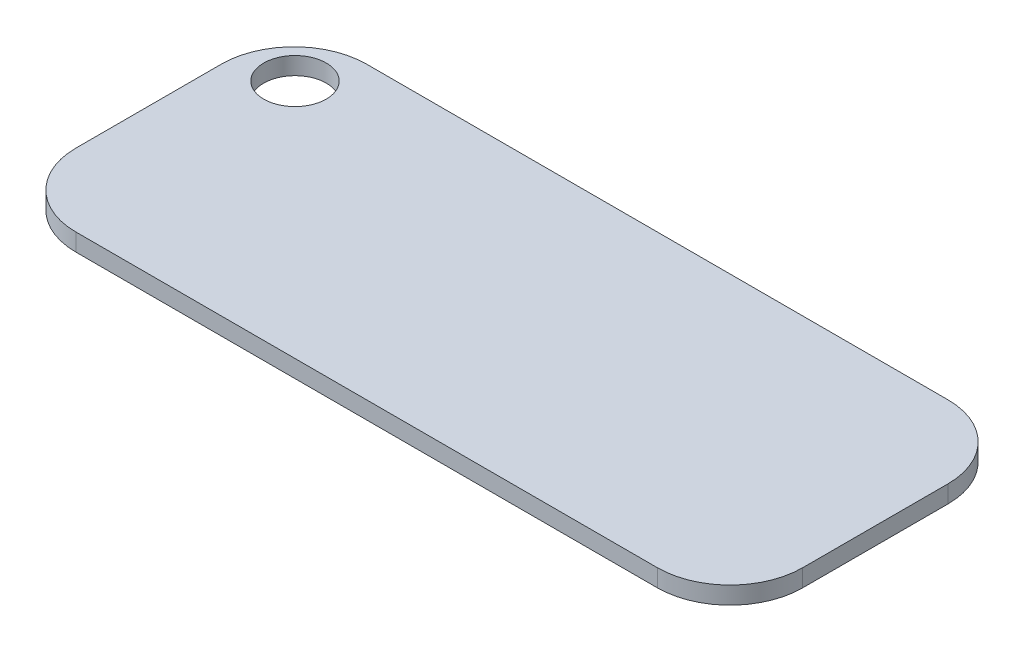
from build123d import *

# Parameters (mm, degrees)
SKETCH_1_W          = 50
SKETCH_1_H          = 20
EXTRUDE_1_DEPTH     = 1.2
FILLET_1_R          = 5
FILLET_2_R          = 5
FILLET_3_R          = 5
FILLET_4_R          = 5
SKETCH_4_R          = 2.151855383
CUT_EXTRUDE_1_DEPTH = 3
EXTRUDE_979_DEPTH   = 1.2


with BuildPart() as part:
    # Эскиз1 → Бобышка-Вытянуть1 (new body)
    with BuildSketch(Plane(origin=(0, 0, 0), x_dir=(1, 0, 0), z_dir=(0, 1, 0))):
        with Locations((25, 10)):
            Rectangle(SKETCH_1_W, SKETCH_1_H)
    extrude(amount=EXTRUDE_1_DEPTH)

    # Скругление1
    fillet_1_edges = [part.edges().sort_by_distance(p)[0] for p in [
        (0, 0.6, -20),
    ]]
    fillet(fillet_1_edges, radius=FILLET_1_R)

    # Скругление2
    fillet_2_edges = [part.edges().sort_by_distance(p)[0] for p in [
        (0, 0.6, 0),
    ]]
    fillet(fillet_2_edges, radius=FILLET_2_R)

    # Скругление3
    fillet_3_edges = [part.edges().sort_by_distance(p)[0] for p in [
        (50, 0.6, -20),
    ]]
    fillet(fillet_3_edges, radius=FILLET_3_R)

    # Скругление4
    fillet_4_edges = [part.edges().sort_by_distance(p)[0] for p in [
        (50, 0.6, 0),
    ]]
    fillet(fillet_4_edges, radius=FILLET_4_R)

    # Эскиз4 → Вырез-Вытянуть1 (cut)
    with BuildSketch(Plane(origin=(0, 1.2, 0), x_dir=(1, 0, 0), z_dir=(0, 1, 0))):
        with Locations((3.542470198, 16.528352227)):
            Circle(SKETCH_4_R)
    extrude(amount=-CUT_EXTRUDE_1_DEPTH, mode=Mode.SUBTRACT)

    # Эскиз5 → Extrude 979 (add)
    # profile 1 of 11: a face of its own
    with BuildSketch(Plane.XZ):
        with BuildLine():
            add(Edge.make_bspline(
                [(7.715824337, -9.249564735), (7.766160171, -9.176893377), (7.868399459, -9.029287442), (7.996414769, -8.785756318), (8.103367923, -8.521510996), (8.188804118, -8.238982947), (8.255316002, -7.946402964), (8.304601491, -7.648663525), (8.336266424, -7.348929067), (8.339569292, -7.147840455), (8.341222147, -7.047209679)],
                knots=[0, 0, 0, 0, 0.911528828, 1.851445597, 2.831681584, 3.849114504, 4.893651631, 5.925632796, 6.961924405, 8, 8, 8, 8], degree=3))
            add(Edge.make_bspline(
                [(8.341222147, -7.047209679), (8.337394851, -6.891153613), (8.329939431, -6.587162586), (8.267622497, -6.145599666), (8.161016823, -5.733040581), (8.040195925, -5.411343759), (7.920866369, -5.176566761), (7.816636073, -5.024690155), (7.700589323, -4.894824065), (7.57301853, -4.785487202), (7.432664091, -4.698075234), (7.279477201, -4.633073953), (7.11396188, -4.591366872), (6.999065368, -4.580856826), (6.940392326, -4.575489767)],
                knots=[0, 0, 0, 0, 1.791554521, 3.489877151, 5.107255168, 6.676714242, 7.425606061, 8.126241729, 8.785513885, 9.420356286, 10.049181088, 10.676513228, 11.324148379, 12, 12, 12, 12], degree=3))
            add(Edge.make_bspline(
                [(6.940392326, -4.575489767), (6.886154354, -4.578981174), (6.779670769, -4.585835735), (6.62434705, -4.6225053), (6.478204695, -4.682081581), (6.338875865, -4.761319869), (6.210355825, -4.865395681), (6.088418762, -4.988989621), (5.976134626, -5.135480832), (5.869842889, -5.301237743), (5.777518117, -5.487913377), (5.693397188, -5.690264555), (5.625099885, -5.909667908), (5.565744196, -6.144202547), (5.521739832, -6.395782298), (5.487528778, -6.663100805), (5.467193402, -6.946988163), (5.462691185, -7.141447456), (5.460376971, -7.241402777)],
                knots=[0, 0, 0, 0, 0.776059093, 1.523610694, 2.26943235, 3.026161316, 3.806370488, 4.625991605, 5.503091466, 6.44030775, 7.436849706, 8.476373815, 9.570387437, 10.718835958, 11.933161742, 13.219262995, 14.570654791, 16, 16, 16, 16], degree=3))
            add(Edge.make_bspline(
                [(5.460376971, -7.241402777), (5.461733402, -7.345205977), (5.464420127, -7.550812276), (5.499663986, -7.854600872), (5.545950319, -8.15144279), (5.618583069, -8.436552089), (5.706959288, -8.707307365), (5.817377371, -8.95757857), (5.94385666, -9.187967423), (6.046973839, -9.325194542), (6.09763199, -9.39260981)],
                knots=[0, 0, 0, 0, 1.089978603, 2.15895528, 3.20972959, 4.244258845, 5.246508595, 6.198517637, 7.11498969, 8, 8, 8, 8], degree=3))
            Line((6.09763199, -9.39260981), (6.098988941, -9.431083139))
            add(Edge.make_bspline(
                [(6.098988941, -9.431083139), (6.046580047, -9.498179954), (5.938103195, -9.637058121), (5.80181535, -9.878082081), (5.673590401, -10.149278895), (5.558843048, -10.455320285), (5.462126569, -10.794625262), (5.393998298, -11.167724706), (5.350100346, -11.572957062), (5.343261965, -11.854153872), (5.339713299, -12.000076353)],
                knots=[0, 0, 0, 0, 0.747893007, 1.548002103, 2.428220339, 3.385024111, 4.419108458, 5.527032265, 6.716693888, 8, 8, 8, 8], degree=3))
            add(Edge.make_bspline(
                [(5.339713299, -12.000076353), (5.341460028, -12.088714681), (5.344907765, -12.263671173), (5.363210958, -12.521189627), (5.396133876, -12.769570928), (5.438259342, -13.008486954), (5.495174212, -13.237691812), (5.565127734, -13.457488871), (5.647994331, -13.667675748), (5.740686073, -13.867401609), (5.847142457, -14.049851366), (5.966225553, -14.211430483), (6.096353113, -14.350581813), (6.239746772, -14.465688202), (6.395620193, -14.556592916), (6.56288249, -14.625344729), (6.742847885, -14.669528283), (6.867251127, -14.679656034), (6.930965477, -14.684843061)],
                knots=[0, 0, 0, 0, 1.235435888, 2.438533473, 3.595508883, 4.725923701, 5.817781028, 6.884189936, 7.938117332, 8.96461166, 9.950003493, 10.876660607, 11.756436375, 12.597656396, 13.429845812, 14.262588117, 15.110167343, 16, 16, 16, 16], degree=3))
            add(Edge.make_bspline(
                [(6.930965477, -14.684843061), (6.991511404, -14.680891948), (7.110089376, -14.673153771), (7.283066801, -14.632398981), (7.446200449, -14.567081516), (7.602237529, -14.480753214), (7.746832747, -14.366618204), (7.882516527, -14.230276873), (8.009592496, -14.070318157), (8.125555071, -13.887279037), (8.230381242, -13.6839446), (8.323136301, -13.462891651), (8.400042388, -13.223587077), (8.463377726, -12.967709417), (8.514540453, -12.69451849), (8.551195511, -12.404916175), (8.576878379, -12.097933978), (8.580623482, -11.887637871), (8.582549491, -11.779488077)],
                knots=[0, 0, 0, 0, 0.789717121, 1.546644996, 2.30406014, 3.074123165, 3.86213959, 4.696104222, 5.576133471, 6.519015237, 7.51540899, 8.554319549, 9.6395583, 10.787721216, 11.987677943, 13.259577382, 14.590672234, 16, 16, 16, 16], degree=3))
            add(Edge.make_bspline(
                [(8.582549491, -11.779488077), (8.577820294, -11.63292157), (8.568700342, -11.350277531), (8.520368129, -10.944489132), (8.442013688, -10.574388766), (8.334499032, -10.241270976), (8.204414839, -9.945234791), (8.059515493, -9.685142102), (7.900128955, -9.460103805), (7.775482844, -9.335769684), (7.715279347, -9.275716877)],
                knots=[0, 0, 0, 0, 1.293490065, 2.494412024, 3.600539669, 4.62641707, 5.577396771, 6.448871158, 7.250811916, 8, 8, 8, 8], degree=3))
            Line((7.715279347, -9.275716877), (7.715824337, -9.249564735))
        make_face()
        with BuildLine():
            add(Edge.make_bspline(
                [(6.957920374, -13.372625625), (6.93174407, -13.369906454), (6.880375206, -13.364570303), (6.80704592, -13.338292077), (6.737587182, -13.300959376), (6.676167386, -13.245401765), (6.613927997, -13.182001522), (6.561187135, -13.101286196), (6.50856116, -13.010335686), (6.449580785, -12.866051618), (6.383209027, -12.666896386), (6.33061405, -12.404759735), (6.29558552, -12.11917452), (6.291868831, -11.920378658), (6.289939718, -11.817195475)],
                knots=[0, 0, 0, 0, 0.516878197, 1.014331308, 1.524422578, 2.060470795, 2.63878414, 3.270961343, 3.953097661, 4.707736148, 6.337157177, 8.083774507, 9.967318802, 12, 12, 12, 12], degree=3))
            add(Edge.make_bspline(
                [(6.289939718, -11.817195475), (6.29252905, -11.720988293), (6.297583526, -11.533188204), (6.324740909, -11.259280602), (6.374704875, -11.00239966), (6.438854186, -10.763165395), (6.522319536, -10.546834695), (6.623308185, -10.359265739), (6.74041941, -10.201548361), (6.834542713, -10.120139111), (6.88006049, -10.080769816)],
                knots=[0, 0, 0, 0, 1.22142396, 2.384266159, 3.488789828, 4.539640758, 5.524731502, 6.424298786, 7.237995119, 8, 8, 8, 8], degree=3))
            add(Edge.make_bspline(
                [(6.88006049, -10.080769816), (6.933694214, -10.119924752), (7.043488746, -10.200079505), (7.184647699, -10.356964741), (7.311950603, -10.541971104), (7.422794465, -10.758524875), (7.516173227, -11.006383783), (7.579908827, -11.288007859), (7.621718216, -11.600416233), (7.62868317, -11.819562187), (7.632323072, -11.934088407)],
                knots=[0, 0, 0, 0, 0.764838737, 1.565714712, 2.420999668, 3.352265673, 4.366974192, 5.470323704, 6.677984882, 8, 8, 8, 8], degree=3))
            add(Edge.make_bspline(
                [(7.632323072, -11.934088407), (7.63037494, -12.029103614), (7.626619945, -12.212243918), (7.591705972, -12.475991169), (7.53793278, -12.718127104), (7.464914984, -12.935040245), (7.373033711, -13.119069678), (7.255852245, -13.258259904), (7.114400274, -13.349030169), (7.009413566, -13.364804591), (6.957920374, -13.372625625)],
                knots=[0, 0, 0, 0, 1.321228345, 2.546646677, 3.694107777, 4.76689393, 5.725035891, 6.536813707, 7.27454525, 8, 8, 8, 8], degree=3))
        make_face(mode=Mode.SUBTRACT)
        with BuildLine():
            add(Edge.make_bspline(
                [(6.907634025, -5.865368148), (6.958753454, -5.873659232), (7.059757483, -5.890041121), (7.193993752, -5.980033754), (7.300393439, -6.115510071), (7.377335324, -6.294038532), (7.435873132, -6.498811019), (7.482230578, -6.723734581), (7.508269288, -6.964256115), (7.510511526, -7.130104495), (7.5116594, -7.215007599)],
                knots=[0, 0, 0, 0, 0.765528405, 1.512564887, 2.346431841, 3.307864738, 4.394490714, 5.524415916, 6.732669124, 8, 8, 8, 8], degree=3))
            add(Edge.make_bspline(
                [(7.5116594, -7.215007599), (7.50859169, -7.297439341), (7.502600293, -7.458432863), (7.471378816, -7.69346882), (7.426042105, -7.916173214), (7.35914447, -8.122395419), (7.28290024, -8.309044003), (7.193034854, -8.469161507), (7.097490457, -8.604667209), (7.019040236, -8.673650731), (6.981870464, -8.706335173)],
                knots=[0, 0, 0, 0, 1.216519099, 2.375925702, 3.494449087, 4.564888535, 5.570675503, 6.463263841, 7.271893284, 8, 8, 8, 8], degree=3))
            add(Edge.make_bspline(
                [(6.981870464, -8.706335173), (6.931695132, -8.668071043), (6.830544781, -8.590932935), (6.697820701, -8.448639437), (6.581068942, -8.285285136), (6.478238966, -8.101310609), (6.395255322, -7.895023443), (6.335588691, -7.666397936), (6.297036284, -7.416145748), (6.292365036, -7.241553526), (6.289939718, -7.150905023)],
                knots=[0, 0, 0, 0, 0.854607252, 1.722835104, 2.626488507, 3.572752242, 4.57465509, 5.633219383, 6.771164507, 8, 8, 8, 8], degree=3))
            add(Edge.make_bspline(
                [(6.289939718, -7.150905023), (6.290938527, -7.070998742), (6.292879216, -6.915740642), (6.320899811, -6.68949647), (6.362615181, -6.475473911), (6.425043796, -6.279448537), (6.503565055, -6.107193558), (6.611838523, -5.974725557), (6.750949296, -5.890187314), (6.853849406, -5.874822953), (6.906455668, -5.866968135)],
                knots=[0, 0, 0, 0, 1.230812713, 2.391472128, 3.50850541, 4.586815455, 5.557221012, 6.409314627, 7.186784035, 8, 8, 8, 8], degree=3))
            Line((6.906455668, -5.866968135), (6.907634025, -5.865368148))
        make_face(mode=Mode.SUBTRACT)
    # profile 2 of 11: a face of its own
    with BuildSketch(Plane.XZ):
        with BuildLine():
            add(Edge.make_bspline(
                [(9.746879914, -14.683467699), (9.806749079, -14.685791262), (9.925235476, -14.6903898), (10.100699733, -14.675658277), (10.270881849, -14.649549564), (10.435392675, -14.610724633), (10.592746251, -14.555039106), (10.744022731, -14.486850339), (10.890198177, -14.406395381), (11.027138099, -14.308508146), (11.161504369, -14.201147354), (11.286074377, -14.076447402), (11.406244824, -13.939039253), (11.520766087, -13.788857432), (11.629050834, -13.624078956), (11.727566217, -13.443723049), (11.824734414, -13.252250259), (11.942845085, -12.973969885), (12.076790331, -12.603481692), (12.216678947, -12.133388078), (12.33202696, -11.633107276), (12.42862629, -11.104752191), (12.500815328, -10.547716704), (12.553819553, -9.962234985), (12.58373682, -9.347051286), (12.586942869, -8.926955308), (12.588583411, -8.711991283)],
                knots=[0, 0, 0, 0, 0.587702947, 1.163116348, 1.725075362, 2.277262808, 2.819713187, 3.360969282, 3.905101247, 4.454524283, 5.011482261, 5.591737658, 6.182009412, 6.802709751, 7.444427068, 8.115602503, 8.819201884, 9.551563824, 11.081795736, 12.684480665, 14.363626865, 16.119590269, 17.955514458, 19.875934814, 21.889706872, 24, 24, 24, 24], degree=3))
            add(Edge.make_bspline(
                [(12.588583411, -8.711991283), (12.586869387, -8.563030602), (12.583519526, -8.271904287), (12.565205506, -7.846144898), (12.532738134, -7.441899869), (12.490283225, -7.058732993), (12.434284214, -6.696886678), (12.364380963, -6.357281746), (12.283783668, -6.039182346), (12.19099992, -5.744535764), (12.085308111, -5.47784443), (11.96638436, -5.242916146), (11.835179087, -5.042250894), (11.691586972, -4.873822341), (11.531300664, -4.744759813), (11.360601652, -4.647552011), (11.176124881, -4.584688618), (11.047449676, -4.572326808), (10.982248274, -4.566062918)],
                knots=[0, 0, 0, 0, 1.488694986, 2.909481093, 4.257746305, 5.540848802, 6.761339651, 7.915469393, 9.004609899, 10.039448099, 11.000449599, 11.868389147, 12.666188125, 13.391717201, 14.070478316, 14.711614416, 15.347158253, 16, 16, 16, 16], degree=3))
            add(Edge.make_bspline(
                [(10.982248274, -4.566062918), (10.92019111, -4.57182076), (10.796792087, -4.583270078), (10.619698699, -4.643474711), (10.452292388, -4.727868466), (10.296452647, -4.844843279), (10.151846729, -4.990751688), (10.017494506, -5.166856512), (9.892833702, -5.371478242), (9.782601041, -5.604506959), (9.680657336, -5.857274449), (9.5955512, -6.127751164), (9.519348562, -6.411165401), (9.457050148, -6.708814108), (9.411315525, -7.021282488), (9.37440803, -7.346884117), (9.35468867, -7.687374952), (9.350017291, -7.918858385), (9.347632589, -8.037028866)],
                knots=[0, 0, 0, 0, 0.71661271, 1.42496533, 2.141431373, 2.872130828, 3.661492946, 4.503891963, 5.421382964, 6.41994004, 7.473922347, 8.56282292, 9.6881508, 10.858187346, 12.067902601, 13.329498283, 14.63672978, 16, 16, 16, 16], degree=3))
            add(Edge.make_bspline(
                [(9.347632589, -8.037028866), (9.349832703, -8.151446831), (9.354115508, -8.374176098), (9.375995599, -8.698562206), (9.404389508, -9.004566486), (9.44790215, -9.290833302), (9.502620155, -9.558297018), (9.567618616, -9.806692284), (9.645098143, -10.036007703), (9.732612398, -10.245016967), (9.831111693, -10.431534039), (9.933318904, -10.596172531), (10.043831438, -10.736839392), (10.161808551, -10.851531059), (10.286209414, -10.943393297), (10.418135522, -11.007161173), (10.555813078, -11.05219231), (10.651328277, -11.058157346), (10.699442792, -11.061162153)],
                knots=[0, 0, 0, 0, 1.529770763, 2.977895321, 4.345668482, 5.637335493, 6.846838563, 7.994249315, 9.067689445, 10.080490039, 11.020068362, 11.884879202, 12.668265517, 13.405073479, 14.079029672, 14.725341234, 15.357907549, 16, 16, 16, 16], degree=3))
            add(Edge.make_bspline(
                [(10.699442792, -11.061162153), (10.749347102, -11.057904189), (10.848200738, -11.051450608), (10.990907393, -11.010821247), (11.123428435, -10.945280034), (11.245873661, -10.855172817), (11.355049257, -10.74006041), (11.460782692, -10.610059787), (11.552186957, -10.458040149), (11.604115759, -10.348336537), (11.630815513, -10.291931242)],
                knots=[0, 0, 0, 0, 0.935406275, 1.852912324, 2.759079899, 3.694486174, 4.685786001, 5.725263117, 6.830419519, 8, 8, 8, 8], degree=3))
            Line((11.630815513, -10.291931242), (11.650930421, -10.304570953))
            add(Edge.make_bspline(
                [(11.650930421, -10.304570953), (11.641221203, -10.397866701), (11.622172671, -10.580903812), (11.581113216, -10.848610475), (11.53780525, -11.105147937), (11.481806627, -11.34943515), (11.42070282, -11.582474068), (11.350144311, -11.804322472), (11.273806089, -12.014864286), (11.189142007, -12.212650827), (11.098109343, -12.395918856), (10.996574073, -12.560106178), (10.886598572, -12.704640128), (10.769276785, -12.830679762), (10.642933971, -12.937021092), (10.507497259, -13.022346658), (10.365255537, -13.090141234), (10.265039818, -13.118830601), (10.214902733, -13.133183651)],
                knots=[0, 0, 0, 0, 1.339989936, 2.628928885, 3.868993049, 5.056241457, 6.208438896, 7.310307185, 8.381264534, 9.407037606, 10.382860463, 11.30231499, 12.160773156, 12.973890012, 13.757980097, 14.51278177, 15.255957167, 16, 16, 16, 16], degree=3))
            add(Edge.make_bspline(
                [(10.214902733, -13.133183651), (10.181551834, -13.138582655), (10.120456644, -13.148473038), (10.037401857, -13.165557307), (9.969681393, -13.173210644), (9.902426193, -13.185134235), (9.82849182, -13.186765219), (9.773002777, -13.17741831), (9.745445633, -13.172776418)],
                knots=[0, 0, 0, 0, 1.282317147, 2.349064382, 3.21602214, 3.867087612, 4.940746315, 6, 6, 6, 6], degree=3))
            Line((9.745445633, -13.172776418), (9.746879914, -14.683467699))
        make_face()
        with BuildLine():
            add(Edge.make_bspline(
                [(10.949543367, -5.876398667), (10.977804564, -5.880640786), (11.035119189, -5.889243941), (11.115297351, -5.929014107), (11.188144281, -5.988144472), (11.257532058, -6.064937627), (11.318083799, -6.164193214), (11.374955345, -6.282252025), (11.425287822, -6.420732366), (11.485906995, -6.638386013), (11.5495803, -6.944821118), (11.600062876, -7.348941738), (11.63231325, -7.797065926), (11.636280204, -8.11049722), (11.638356992, -8.274585471)],
                knots=[0, 0, 0, 0, 0.388324956, 0.787535614, 1.2030177, 1.664837744, 2.193361997, 2.784441419, 3.452382468, 4.202091393, 5.868356787, 7.720494359, 9.759583653, 12, 12, 12, 12], degree=3))
            add(Edge.make_bspline(
                [(11.638356992, -8.274585471), (11.63876574, -8.319841589), (11.639537997, -8.405345005), (11.634448164, -8.525960585), (11.631699085, -8.632259893), (11.62385486, -8.749176617), (11.615048889, -8.872233208), (11.594648351, -8.962260682), (11.585566636, -9.002338244)],
                knots=[0, 0, 0, 0, 1.11380462, 2.104336476, 2.971181265, 3.730606527, 4.989733304, 6, 6, 6, 6], degree=3))
            add(Edge.make_bspline(
                [(11.585566636, -9.002338244), (11.555831834, -9.097405435), (11.498203191, -9.281653961), (11.378343184, -9.487551177), (11.26559534, -9.622058024), (11.173129126, -9.697058423), (11.070570318, -9.745119038), (10.997798069, -9.753961936), (10.961509205, -9.758371566)],
                knots=[0, 0, 0, 0, 1.717293694, 3.328265295, 4.075010403, 4.73980506, 5.371586794, 6, 6, 6, 6], degree=3))
            add(Edge.make_bspline(
                [(10.961509205, -9.758371566), (10.93680703, -9.756288935), (10.887466675, -9.752129068), (10.81566893, -9.726420604), (10.749856912, -9.684062288), (10.687738263, -9.626591417), (10.628412973, -9.555944951), (10.573027149, -9.469008351), (10.52297173, -9.366858202), (10.457817514, -9.204476703), (10.39162769, -8.966720574), (10.334330785, -8.642323418), (10.299599682, -8.269034586), (10.294760983, -8.003798002), (10.292202898, -7.863574837)],
                knots=[0, 0, 0, 0, 0.413789282, 0.826506569, 1.261562931, 1.716042024, 2.238855857, 2.802250335, 3.437615293, 4.141140511, 5.729823065, 7.558733105, 9.652026376, 12, 12, 12, 12], degree=3))
            add(Edge.make_bspline(
                [(10.292202898, -7.863574837), (10.294961987, -7.72524339), (10.300225719, -7.461337582), (10.333358307, -7.085096314), (10.388597617, -6.74882214), (10.454004327, -6.496676145), (10.514976333, -6.318557732), (10.566291983, -6.206445304), (10.617783946, -6.108098477), (10.676793407, -6.029229338), (10.737169657, -5.964075945), (10.803795424, -5.918721859), (10.874304734, -5.888000953), (10.923512636, -5.881537632), (10.948311616, -5.878280354)],
                knots=[0, 0, 0, 0, 2.244031887, 4.281116543, 6.121417338, 7.765846703, 8.501017567, 9.171798035, 9.76494997, 10.29714384, 10.765780613, 11.198437351, 11.596041788, 12, 12, 12, 12], degree=3))
            Line((10.948311616, -5.878280354), (10.949543367, -5.876398667))
        make_face(mode=Mode.SUBTRACT)
    # profile 3 of 11: a face of its own
    with BuildSketch(Plane.XZ):
        Polygon((15.629309794, -4.687908629), (14.811059267, -4.687908629), (13.624055062, -5.875750571), (13.829913886, -7.242157661), (14.666215357, -6.35598963), (14.679081534, -6.35598963), (14.679081534, -14.487884509), (15.629309794, -14.487884509), align=None)
    # profile 4 of 11: a face of its own
    with BuildSketch(Plane.XZ):
        with BuildLine():
            add(Edge.make_bspline(
                [(18.972766926, -14.673530842), (19.03576325, -14.668102479), (19.162148546, -14.657211918), (19.344728517, -14.590406449), (19.513878924, -14.480532201), (19.671691523, -14.331143763), (19.813891716, -14.138422555), (19.94826018, -13.908570439), (20.069298666, -13.637433252), (20.179271401, -13.327583953), (20.279331022, -12.980913937), (20.361863761, -12.597453334), (20.435961623, -12.180014656), (20.495200471, -11.727634509), (20.542085664, -11.240288198), (20.575245658, -10.718395021), (20.596267551, -10.161384017), (20.599160231, -9.778501893), (20.600651252, -9.581146798)],
                knots=[0, 0, 0, 0, 0.529751383, 1.062804646, 1.61385316, 2.215574753, 2.879125032, 3.620281667, 4.450123201, 5.370886135, 6.382468459, 7.480938196, 8.666507297, 9.945632662, 11.315014225, 12.78147403, 14.341023359, 16, 16, 16, 16], degree=3))
            add(Edge.make_bspline(
                [(20.600651252, -9.581146798), (20.600471641, -9.410187118), (20.600119587, -9.075088507), (20.581353726, -8.582945817), (20.556684217, -8.111290272), (20.517148116, -7.660404918), (20.464397977, -7.230997445), (20.400434619, -6.822213548), (20.32496942, -6.434220694), (20.2411293, -6.068849042), (20.14089918, -5.735857456), (20.027927625, -5.440781042), (19.895694797, -5.189324204), (19.74911186, -4.979799798), (19.587738389, -4.81009163), (19.407253239, -4.68815149), (19.212208345, -4.603037297), (19.073700235, -4.585986901), (19.003742964, -4.577375137)],
                knots=[0, 0, 0, 0, 1.462772537, 2.867185112, 4.213715228, 5.503936185, 6.739261869, 7.915146218, 9.043642378, 10.121075315, 11.121384378, 12.017154031, 12.820647149, 13.545818879, 14.199911066, 14.811456886, 15.399694113, 16, 16, 16, 16], degree=3))
            add(Edge.make_bspline(
                [(19.003742964, -4.577375137), (18.936398008, -4.58420557), (18.802208066, -4.597815726), (18.611344159, -4.676924424), (18.433505392, -4.793253707), (18.271596868, -4.955184615), (18.12267181, -5.156637113), (17.990253475, -5.401598252), (17.867438131, -5.685951925), (17.76060482, -6.01150079), (17.665916283, -6.371305995), (17.584066181, -6.760435346), (17.511253481, -7.175813241), (17.456707415, -7.619633952), (17.410942073, -8.090444969), (17.379628934, -8.589090372), (17.360445021, -9.114677258), (17.358705732, -9.474291788), (17.357815059, -9.658446963)],
                knots=[0, 0, 0, 0, 0.566917839, 1.129626877, 1.717802694, 2.346074211, 3.045200701, 3.819275146, 4.683807342, 5.648743943, 6.699322103, 7.813300624, 8.993971249, 10.246825329, 11.574997533, 12.974020352, 14.450424652, 16, 16, 16, 16], degree=3))
            add(Edge.make_bspline(
                [(17.357815059, -9.658446963), (17.358050533, -9.830032088), (17.35851212, -10.16638136), (17.376475076, -10.659859561), (17.40388833, -11.132718633), (17.444835636, -11.584273236), (17.500039313, -12.015497517), (17.565324135, -12.425602543), (17.642199833, -12.815182532), (17.731310552, -13.179839736), (17.831595468, -13.513907302), (17.950667773, -13.807809335), (18.08098519, -14.061191552), (18.228124823, -14.271889237), (18.391269004, -14.439542632), (18.570244405, -14.563384484), (18.764616178, -14.647478301), (18.902403718, -14.6648136), (18.971691676, -14.673530842)],
                knots=[0, 0, 0, 0, 1.464767554, 2.871306572, 4.215045025, 5.508116909, 6.741261956, 7.92587706, 9.052808243, 10.130273157, 11.12984833, 12.027539368, 12.833925245, 13.557426221, 14.213772112, 14.819481535, 15.406363497, 16, 16, 16, 16], degree=3))
            Line((18.971691676, -14.673530842), (18.972766926, -14.673530842))
        make_face()
        with BuildLine():
            add(Edge.make_bspline(
                [(18.979282867, -13.1426105), (18.952338234, -13.138634448), (18.896466738, -13.130389839), (18.818309136, -13.082670508), (18.748649535, -13.008182197), (18.684677145, -12.907176417), (18.625283396, -12.780368181), (18.57129502, -12.62671794), (18.523157271, -12.446195341), (18.478137311, -12.239274359), (18.439017432, -12.005169409), (18.406119931, -11.74403528), (18.374783935, -11.456311501), (18.354844607, -11.141034987), (18.331732973, -10.799352398), (18.32081641, -10.430231948), (18.310179722, -10.033694992), (18.308770368, -9.76026622), (18.308041478, -9.618854195)],
                knots=[0, 0, 0, 0, 0.348295693, 0.722214362, 1.152022054, 1.655502919, 2.257207495, 2.954417897, 3.752591885, 4.664981709, 5.684162841, 6.811961843, 8.058606191, 9.415432032, 10.884928106, 12.474287767, 14.176570434, 16, 16, 16, 16], degree=3))
            add(Edge.make_bspline(
                [(18.308041478, -9.618854195), (18.30941896, -9.477441654), (18.312082503, -9.204001949), (18.324212127, -8.807444082), (18.338369674, -8.438438755), (18.358806594, -8.096443906), (18.385710923, -7.781624632), (18.414479727, -7.493460125), (18.451044809, -7.232723351), (18.489010998, -6.99896953), (18.534679102, -6.793465289), (18.582206656, -6.613711289), (18.638585677, -6.46294573), (18.696145907, -6.336085282), (18.761633977, -6.238480326), (18.829727209, -6.16365709), (18.908122446, -6.11856598), (18.963677634, -6.111643396), (18.990545375, -6.108295479)],
                knots=[0, 0, 0, 0, 1.828192425, 3.535049952, 5.128793054, 6.602054755, 7.963618568, 9.213457478, 10.345225998, 11.367018811, 12.273810474, 13.066196316, 13.7679736, 14.353056012, 14.862318632, 15.281738881, 15.652632741, 16, 16, 16, 16], degree=3))
            add(Edge.make_bspline(
                [(18.990545375, -6.108295479), (19.018784895, -6.112078021), (19.076896818, -6.119861819), (19.157008041, -6.169820022), (19.227111205, -6.24744369), (19.292894745, -6.350850206), (19.352073958, -6.4825727), (19.406623673, -6.641522724), (19.451838802, -6.829429827), (19.495187156, -7.043161198), (19.532215099, -7.282916854), (19.564141873, -7.547019494), (19.589455751, -7.835091299), (19.612742116, -8.146146123), (19.628690247, -8.480629755), (19.642403665, -8.838842231), (19.649780265, -9.221009753), (19.650205916, -9.483733299), (19.650424832, -9.618854195)],
                knots=[0, 0, 0, 0, 0.365144164, 0.751401903, 1.188481301, 1.711676837, 2.330067746, 3.052575452, 3.882751645, 4.828291963, 5.87357693, 7.020192641, 8.269339261, 9.614396851, 11.055335144, 12.60115741, 14.251947096, 16, 16, 16, 16], degree=3))
            add(Edge.make_bspline(
                [(19.650424832, -9.618854195), (19.650438022, -9.757750523), (19.65046363, -10.027409233), (19.639962692, -10.418951375), (19.626819525, -10.784722199), (19.611411543, -11.124953243), (19.585861364, -11.43910408), (19.558475536, -11.728413997), (19.525144709, -11.991992139), (19.485264431, -12.229541748), (19.443306654, -12.440750382), (19.394748937, -12.624167144), (19.341259616, -12.779978206), (19.280664663, -12.9073605), (19.21797555, -13.009895539), (19.147612996, -13.084342909), (19.069242801, -13.133104141), (19.012501383, -13.139498708), (18.984889265, -13.1426105)],
                knots=[0, 0, 0, 0, 1.790021536, 3.475217123, 5.04755471, 6.507297142, 7.864016094, 9.109190405, 10.252463025, 11.287084988, 12.2131664, 13.026557634, 13.73103331, 14.332422383, 14.842437598, 15.272019921, 15.645742526, 16, 16, 16, 16], degree=3))
            Line((18.984889265, -13.1426105), (18.979282867, -13.1426105))
        make_face(mode=Mode.SUBTRACT)
    # profile 5 of 11: a face of its own
    with BuildSketch(Plane.XZ):
        with BuildLine():
            add(Edge.make_bspline(
                [(21.764981674, -14.683467699), (21.824850839, -14.685791262), (21.943337236, -14.6903898), (22.118801493, -14.675658277), (22.288983609, -14.649549564), (22.453494435, -14.610724633), (22.610848012, -14.555039106), (22.762124491, -14.486850339), (22.908299937, -14.406395381), (23.045239859, -14.308508146), (23.17960613, -14.201147354), (23.304176137, -14.076447402), (23.424346584, -13.939039253), (23.538867847, -13.788857432), (23.647152594, -13.624078956), (23.745667977, -13.443723049), (23.842836174, -13.252250259), (23.960946845, -12.973969885), (24.094892092, -12.603481692), (24.234780707, -12.133388078), (24.350128721, -11.633107276), (24.446728051, -11.104752191), (24.518917088, -10.547716704), (24.571921313, -9.962234985), (24.60183858, -9.347051286), (24.605044629, -8.926955308), (24.606685172, -8.711991283)],
                knots=[0, 0, 0, 0, 0.587702947, 1.163116348, 1.725075362, 2.277262808, 2.819713187, 3.360969282, 3.905101247, 4.454524283, 5.011482261, 5.591737658, 6.182009412, 6.802709751, 7.444427068, 8.115602503, 8.819201884, 9.551563824, 11.081795736, 12.684480665, 14.363626865, 16.119590269, 17.955514458, 19.875934814, 21.889706872, 24, 24, 24, 24], degree=3))
            add(Edge.make_bspline(
                [(24.606685172, -8.711991283), (24.604971147, -8.563030602), (24.601621286, -8.271904287), (24.583307267, -7.846144898), (24.550839894, -7.441899869), (24.508384985, -7.058732993), (24.452385975, -6.696886678), (24.382482723, -6.357281746), (24.301885428, -6.039182346), (24.20910168, -5.744535764), (24.103409871, -5.47784443), (23.98448612, -5.242916146), (23.853280848, -5.042250894), (23.709688732, -4.873822341), (23.549402424, -4.744759813), (23.378703412, -4.647552011), (23.194226641, -4.584688618), (23.065551436, -4.572326808), (23.000350034, -4.566062918)],
                knots=[0, 0, 0, 0, 1.488694986, 2.909481093, 4.257746305, 5.540848802, 6.761339651, 7.915469393, 9.004609899, 10.039448099, 11.000449599, 11.868389147, 12.666188125, 13.391717201, 14.070478316, 14.711614416, 15.347158253, 16, 16, 16, 16], degree=3))
            add(Edge.make_bspline(
                [(23.000350034, -4.566062918), (22.93829287, -4.57182076), (22.814893848, -4.583270078), (22.637800459, -4.643474711), (22.470394148, -4.727868466), (22.314554407, -4.844843279), (22.169948489, -4.990751688), (22.035596266, -5.166856512), (21.910935462, -5.371478242), (21.800702802, -5.604506959), (21.698759096, -5.857274449), (21.61365296, -6.127751164), (21.537450322, -6.411165401), (21.475151908, -6.708814108), (21.429417285, -7.021282488), (21.392509791, -7.346884117), (21.372790431, -7.687374952), (21.368119051, -7.918858385), (21.365734349, -8.037028866)],
                knots=[0, 0, 0, 0, 0.71661271, 1.42496533, 2.141431373, 2.872130828, 3.661492946, 4.503891963, 5.421382964, 6.41994004, 7.473922347, 8.56282292, 9.6881508, 10.858187346, 12.067902601, 13.329498283, 14.63672978, 16, 16, 16, 16], degree=3))
            add(Edge.make_bspline(
                [(21.365734349, -8.037028866), (21.367934463, -8.151446831), (21.372217268, -8.374176098), (21.39409736, -8.698562206), (21.422491268, -9.004566486), (21.46600391, -9.290833302), (21.520721915, -9.558297018), (21.585720376, -9.806692284), (21.663199903, -10.036007703), (21.750714158, -10.245016967), (21.849213453, -10.431534039), (21.951420664, -10.596172531), (22.061933199, -10.736839392), (22.179910311, -10.851531059), (22.304311174, -10.943393297), (22.436237283, -11.007161173), (22.573914838, -11.05219231), (22.669430037, -11.058157346), (22.717544552, -11.061162153)],
                knots=[0, 0, 0, 0, 1.529770763, 2.977895321, 4.345668482, 5.637335493, 6.846838563, 7.994249315, 9.067689445, 10.080490039, 11.020068362, 11.884879202, 12.668265517, 13.405073479, 14.079029672, 14.725341234, 15.357907549, 16, 16, 16, 16], degree=3))
            add(Edge.make_bspline(
                [(22.717544552, -11.061162153), (22.767448863, -11.057904189), (22.866302499, -11.051450608), (23.009009154, -11.010821247), (23.141530195, -10.945280034), (23.263975422, -10.855172817), (23.373151017, -10.74006041), (23.478884452, -10.610059787), (23.570288717, -10.458040149), (23.62221752, -10.348336537), (23.648917273, -10.291931242)],
                knots=[0, 0, 0, 0, 0.935406275, 1.852912324, 2.759079899, 3.694486174, 4.685786001, 5.725263117, 6.830419519, 8, 8, 8, 8], degree=3))
            Line((23.648917273, -10.291931242), (23.669032181, -10.304570953))
            add(Edge.make_bspline(
                [(23.669032181, -10.304570953), (23.659322964, -10.397866701), (23.640274431, -10.580903812), (23.599214976, -10.848610475), (23.55590701, -11.105147937), (23.499908388, -11.34943515), (23.43880458, -11.582474068), (23.368246072, -11.804322472), (23.291907849, -12.014864286), (23.207243767, -12.212650827), (23.116211103, -12.395918856), (23.014675834, -12.560106178), (22.904700332, -12.704640128), (22.787378545, -12.830679762), (22.661035731, -12.937021092), (22.52559902, -13.022346658), (22.383357297, -13.090141234), (22.283141579, -13.118830601), (22.233004493, -13.133183651)],
                knots=[0, 0, 0, 0, 1.339989936, 2.628928885, 3.868993049, 5.056241457, 6.208438896, 7.310307185, 8.381264534, 9.407037606, 10.382860463, 11.30231499, 12.160773156, 12.973890012, 13.757980097, 14.51278177, 15.255957167, 16, 16, 16, 16], degree=3))
            add(Edge.make_bspline(
                [(22.233004493, -13.133183651), (22.199653594, -13.138582655), (22.138558404, -13.148473038), (22.055503617, -13.165557307), (21.987783153, -13.173210644), (21.920527954, -13.185134235), (21.84659358, -13.186765219), (21.791104537, -13.17741831), (21.763547393, -13.172776418)],
                knots=[0, 0, 0, 0, 1.282317147, 2.349064382, 3.21602214, 3.867087612, 4.940746315, 6, 6, 6, 6], degree=3))
            Line((21.763547393, -13.172776418), (21.764981674, -14.683467699))
        make_face()
        with BuildLine():
            add(Edge.make_bspline(
                [(22.967645127, -5.876398667), (22.995906324, -5.880640786), (23.05322095, -5.889243941), (23.133399111, -5.929014107), (23.206246041, -5.988144472), (23.275633818, -6.064937627), (23.336185559, -6.164193214), (23.393057106, -6.282252025), (23.443389583, -6.420732366), (23.504008755, -6.638386013), (23.56768206, -6.944821118), (23.618164637, -7.348941738), (23.650415011, -7.797065926), (23.654381964, -8.11049722), (23.656458752, -8.274585471)],
                knots=[0, 0, 0, 0, 0.388324956, 0.787535614, 1.2030177, 1.664837744, 2.193361997, 2.784441419, 3.452382468, 4.202091393, 5.868356787, 7.720494359, 9.759583653, 12, 12, 12, 12], degree=3))
            add(Edge.make_bspline(
                [(23.656458752, -8.274585471), (23.6568675, -8.319841589), (23.657639757, -8.405345005), (23.652549924, -8.525960585), (23.649800845, -8.632259893), (23.64195662, -8.749176617), (23.633150649, -8.872233208), (23.612750111, -8.962260682), (23.603668396, -9.002338244)],
                knots=[0, 0, 0, 0, 1.11380462, 2.104336476, 2.971181265, 3.730606527, 4.989733304, 6, 6, 6, 6], degree=3))
            add(Edge.make_bspline(
                [(23.603668396, -9.002338244), (23.573933595, -9.097405435), (23.516304951, -9.281653961), (23.396444945, -9.487551177), (23.283697101, -9.622058024), (23.191230886, -9.697058423), (23.088672078, -9.745119038), (23.015899829, -9.753961936), (22.979610966, -9.758371566)],
                knots=[0, 0, 0, 0, 1.717293694, 3.328265295, 4.075010403, 4.73980506, 5.371586794, 6, 6, 6, 6], degree=3))
            add(Edge.make_bspline(
                [(22.979610966, -9.758371566), (22.95490879, -9.756288935), (22.905568435, -9.752129068), (22.83377069, -9.726420604), (22.767958673, -9.684062288), (22.705840023, -9.626591417), (22.646514733, -9.555944951), (22.591128909, -9.469008351), (22.54107349, -9.366858202), (22.475919274, -9.204476703), (22.40972945, -8.966720574), (22.352432545, -8.642323418), (22.317701443, -8.269034586), (22.312862743, -8.003798002), (22.310304658, -7.863574837)],
                knots=[0, 0, 0, 0, 0.413789282, 0.826506569, 1.261562931, 1.716042024, 2.238855857, 2.802250335, 3.437615293, 4.141140511, 5.729823065, 7.558733105, 9.652026376, 12, 12, 12, 12], degree=3))
            add(Edge.make_bspline(
                [(22.310304658, -7.863574837), (22.313063747, -7.72524339), (22.318327479, -7.461337582), (22.351460067, -7.085096314), (22.406699377, -6.74882214), (22.472106087, -6.496676145), (22.533078093, -6.318557732), (22.584393743, -6.206445304), (22.635885706, -6.108098477), (22.694895167, -6.029229338), (22.755271417, -5.964075945), (22.821897185, -5.918721859), (22.892406494, -5.888000953), (22.941614396, -5.881537632), (22.966413377, -5.878280354)],
                knots=[0, 0, 0, 0, 2.244031887, 4.281116543, 6.121417338, 7.765846703, 8.501017567, 9.171798035, 9.76494997, 10.29714384, 10.765780613, 11.198437351, 11.596041788, 12, 12, 12, 12], degree=3))
            Line((22.966413377, -5.878280354), (22.967645127, -5.876398667))
        make_face(mode=Mode.SUBTRACT)
    # profile 6 of 11: a face of its own
    with BuildSketch(Plane.XZ):
        with BuildLine():
            add(Edge.make_bspline(
                [(26.984834766, -14.673530842), (27.04783109, -14.668102479), (27.174216387, -14.657211918), (27.356796357, -14.590406449), (27.525946764, -14.480532201), (27.683759363, -14.331143763), (27.825959556, -14.138422555), (27.96032802, -13.908570439), (28.081366506, -13.637433252), (28.191339241, -13.327583953), (28.291398862, -12.980913937), (28.373931601, -12.597453334), (28.448029463, -12.180014656), (28.507268311, -11.727634509), (28.554153504, -11.240288198), (28.587313498, -10.718395021), (28.608335391, -10.161384017), (28.611228071, -9.778501893), (28.612719092, -9.581146798)],
                knots=[0, 0, 0, 0, 0.529751383, 1.062804646, 1.61385316, 2.215574753, 2.879125032, 3.620281667, 4.450123201, 5.370886135, 6.382468459, 7.480938196, 8.666507297, 9.945632662, 11.315014225, 12.78147403, 14.341023359, 16, 16, 16, 16], degree=3))
            add(Edge.make_bspline(
                [(28.612719092, -9.581146798), (28.612539482, -9.410187118), (28.612187427, -9.075088507), (28.593421567, -8.582945817), (28.568752057, -8.111290272), (28.529215956, -7.660404918), (28.476465817, -7.230997445), (28.412502459, -6.822213548), (28.337037261, -6.434220694), (28.25319714, -6.068849042), (28.15296702, -5.735857456), (28.039995465, -5.440781042), (27.907762637, -5.189324204), (27.7611797, -4.979799798), (27.59980623, -4.81009163), (27.419321079, -4.68815149), (27.224276185, -4.603037297), (27.085768076, -4.585986901), (27.015810804, -4.577375137)],
                knots=[0, 0, 0, 0, 1.462772537, 2.867185112, 4.213715228, 5.503936185, 6.739261869, 7.915146218, 9.043642378, 10.121075315, 11.121384378, 12.017154031, 12.820647149, 13.545818879, 14.199911066, 14.811456886, 15.399694113, 16, 16, 16, 16], degree=3))
            add(Edge.make_bspline(
                [(27.015810804, -4.577375137), (26.948465848, -4.58420557), (26.814275906, -4.597815726), (26.623411999, -4.676924424), (26.445573232, -4.793253707), (26.283664708, -4.955184615), (26.13473965, -5.156637113), (26.002321316, -5.401598252), (25.879505972, -5.685951925), (25.772672661, -6.01150079), (25.677984123, -6.371305995), (25.596134021, -6.760435346), (25.523321321, -7.175813241), (25.468775255, -7.619633952), (25.423009913, -8.090444969), (25.391696774, -8.589090372), (25.372512861, -9.114677258), (25.370773572, -9.474291788), (25.369882899, -9.658446963)],
                knots=[0, 0, 0, 0, 0.566917839, 1.129626877, 1.717802694, 2.346074211, 3.045200701, 3.819275146, 4.683807342, 5.648743943, 6.699322103, 7.813300624, 8.993971249, 10.246825329, 11.574997533, 12.974020352, 14.450424652, 16, 16, 16, 16], degree=3))
            add(Edge.make_bspline(
                [(25.369882899, -9.658446963), (25.370118373, -9.830032088), (25.37057996, -10.16638136), (25.388542916, -10.659859561), (25.415956171, -11.132718633), (25.456903476, -11.584273236), (25.512107153, -12.015497517), (25.577391975, -12.425602543), (25.654267673, -12.815182532), (25.743378392, -13.179839736), (25.843663309, -13.513907302), (25.962735613, -13.807809335), (26.09305303, -14.061191552), (26.240192663, -14.271889237), (26.403336844, -14.439542632), (26.582312245, -14.563384484), (26.776684018, -14.647478301), (26.914471558, -14.6648136), (26.983759516, -14.673530842)],
                knots=[0, 0, 0, 0, 1.464767554, 2.871306572, 4.215045025, 5.508116909, 6.741261956, 7.92587706, 9.052808243, 10.130273157, 11.12984833, 12.027539368, 12.833925245, 13.557426221, 14.213772112, 14.819481535, 15.406363497, 16, 16, 16, 16], degree=3))
            Line((26.983759516, -14.673530842), (26.984834766, -14.673530842))
        make_face()
        with BuildLine():
            add(Edge.make_bspline(
                [(26.991350707, -13.1426105), (26.964406074, -13.138634448), (26.908534578, -13.130389839), (26.830376976, -13.082670508), (26.760717375, -13.008182197), (26.696744985, -12.907176417), (26.637351236, -12.780368181), (26.58336286, -12.62671794), (26.535225111, -12.446195341), (26.490205151, -12.239274359), (26.451085272, -12.005169409), (26.418187771, -11.74403528), (26.386851775, -11.456311501), (26.366912447, -11.141034987), (26.343800813, -10.799352398), (26.33288425, -10.430231948), (26.322247562, -10.033694992), (26.320838208, -9.76026622), (26.320109318, -9.618854195)],
                knots=[0, 0, 0, 0, 0.348295693, 0.722214362, 1.152022054, 1.655502919, 2.257207495, 2.954417897, 3.752591885, 4.664981709, 5.684162841, 6.811961843, 8.058606191, 9.415432032, 10.884928106, 12.474287767, 14.176570434, 16, 16, 16, 16], degree=3))
            add(Edge.make_bspline(
                [(26.320109318, -9.618854195), (26.3214868, -9.477441654), (26.324150343, -9.204001949), (26.336279967, -8.807444082), (26.350437514, -8.438438755), (26.370874434, -8.096443906), (26.397778763, -7.781624632), (26.426547567, -7.493460125), (26.463112649, -7.232723351), (26.501078839, -6.99896953), (26.546746942, -6.793465289), (26.594274497, -6.613711289), (26.650653518, -6.46294573), (26.708213747, -6.336085282), (26.773701817, -6.238480326), (26.841795049, -6.16365709), (26.920190286, -6.11856598), (26.975745474, -6.111643396), (27.002613215, -6.108295479)],
                knots=[0, 0, 0, 0, 1.828192425, 3.535049952, 5.128793054, 6.602054755, 7.963618568, 9.213457478, 10.345225998, 11.367018811, 12.273810474, 13.066196316, 13.7679736, 14.353056012, 14.862318632, 15.281738881, 15.652632741, 16, 16, 16, 16], degree=3))
            add(Edge.make_bspline(
                [(27.002613215, -6.108295479), (27.030852735, -6.112078021), (27.088964658, -6.119861819), (27.169075881, -6.169820022), (27.239179045, -6.24744369), (27.304962586, -6.350850206), (27.364141798, -6.4825727), (27.418691513, -6.641522724), (27.463906642, -6.829429827), (27.507254996, -7.043161198), (27.544282939, -7.282916854), (27.576209713, -7.547019494), (27.601523592, -7.835091299), (27.624809957, -8.146146123), (27.640758087, -8.480629755), (27.654471505, -8.838842231), (27.661848105, -9.221009753), (27.662273757, -9.483733299), (27.662492673, -9.618854195)],
                knots=[0, 0, 0, 0, 0.365144164, 0.751401903, 1.188481301, 1.711676837, 2.330067746, 3.052575452, 3.882751645, 4.828291963, 5.87357693, 7.020192641, 8.269339261, 9.614396851, 11.055335144, 12.60115741, 14.251947096, 16, 16, 16, 16], degree=3))
            add(Edge.make_bspline(
                [(27.662492673, -9.618854195), (27.662505863, -9.757750523), (27.66253147, -10.027409233), (27.652030532, -10.418951375), (27.638887365, -10.784722199), (27.623479383, -11.124953243), (27.597929204, -11.43910408), (27.570543376, -11.728413997), (27.53721255, -11.991992139), (27.497332271, -12.229541748), (27.455374494, -12.440750382), (27.406816777, -12.624167144), (27.353327456, -12.779978206), (27.292732503, -12.9073605), (27.23004339, -13.009895539), (27.159680836, -13.084342909), (27.081310641, -13.133104141), (27.024569223, -13.139498708), (26.996957105, -13.1426105)],
                knots=[0, 0, 0, 0, 1.790021536, 3.475217123, 5.04755471, 6.507297142, 7.864016094, 9.109190405, 10.252463025, 11.287084988, 12.2131664, 13.026557634, 13.73103331, 14.332422383, 14.842437598, 15.272019921, 15.645742526, 16, 16, 16, 16], degree=3))
            Line((26.996957105, -13.1426105), (26.991350707, -13.1426105))
        make_face(mode=Mode.SUBTRACT)
    # profile 7 of 11: a face of its own
    with BuildSketch(Plane.XZ):
        with BuildLine():
            add(Edge.make_bspline(
                [(30.990868686, -14.673530842), (31.05386501, -14.668102479), (31.180250307, -14.657211918), (31.362830277, -14.590406449), (31.531980684, -14.480532201), (31.689793283, -14.331143763), (31.831993476, -14.138422555), (31.96636194, -13.908570439), (32.087400426, -13.637433252), (32.197373161, -13.327583953), (32.297432782, -12.980913937), (32.379965521, -12.597453334), (32.454063384, -12.180014656), (32.513302232, -11.727634509), (32.560187424, -11.240288198), (32.593347418, -10.718395021), (32.614369311, -10.161384017), (32.617261991, -9.778501893), (32.618753012, -9.581146798)],
                knots=[0, 0, 0, 0, 0.529751383, 1.062804646, 1.61385316, 2.215574753, 2.879125032, 3.620281667, 4.450123201, 5.370886135, 6.382468459, 7.480938196, 8.666507297, 9.945632662, 11.315014225, 12.78147403, 14.341023359, 16, 16, 16, 16], degree=3))
            add(Edge.make_bspline(
                [(32.618753012, -9.581146798), (32.618573402, -9.410187118), (32.618221347, -9.075088507), (32.599455487, -8.582945817), (32.574785977, -8.111290272), (32.535249876, -7.660404918), (32.482499737, -7.230997445), (32.418536379, -6.822213548), (32.343071181, -6.434220694), (32.25923106, -6.068849042), (32.15900094, -5.735857456), (32.046029385, -5.440781042), (31.913796557, -5.189324204), (31.76721362, -4.979799798), (31.60584015, -4.81009163), (31.425354999, -4.68815149), (31.230310105, -4.603037297), (31.091801996, -4.585986901), (31.021844724, -4.577375137)],
                knots=[0, 0, 0, 0, 1.462772537, 2.867185112, 4.213715228, 5.503936185, 6.739261869, 7.915146218, 9.043642378, 10.121075315, 11.121384378, 12.017154031, 12.820647149, 13.545818879, 14.199911066, 14.811456886, 15.399694113, 16, 16, 16, 16], degree=3))
            add(Edge.make_bspline(
                [(31.021844724, -4.577375137), (30.954499768, -4.58420557), (30.820309826, -4.597815726), (30.629445919, -4.676924424), (30.451607152, -4.793253707), (30.289698628, -4.955184615), (30.14077357, -5.156637113), (30.008355236, -5.401598252), (29.885539892, -5.685951925), (29.778706581, -6.01150079), (29.684018043, -6.371305995), (29.602167941, -6.760435346), (29.529355241, -7.175813241), (29.474809175, -7.619633952), (29.429043833, -8.090444969), (29.397730695, -8.589090372), (29.378546781, -9.114677258), (29.376807492, -9.474291788), (29.375916819, -9.658446963)],
                knots=[0, 0, 0, 0, 0.566917839, 1.129626877, 1.717802694, 2.346074211, 3.045200701, 3.819275146, 4.683807342, 5.648743943, 6.699322103, 7.813300624, 8.993971249, 10.246825329, 11.574997533, 12.974020352, 14.450424652, 16, 16, 16, 16], degree=3))
            add(Edge.make_bspline(
                [(29.375916819, -9.658446963), (29.376152293, -9.830032088), (29.37661388, -10.16638136), (29.394576836, -10.659859561), (29.421990091, -11.132718633), (29.462937396, -11.584273236), (29.518141074, -12.015497517), (29.583425895, -12.425602543), (29.660301593, -12.815182532), (29.749412312, -13.179839736), (29.849697229, -13.513907302), (29.968769533, -13.807809335), (30.09908695, -14.061191552), (30.246226583, -14.271889237), (30.409370764, -14.439542632), (30.588346165, -14.563384484), (30.782717938, -14.647478301), (30.920505478, -14.6648136), (30.989793436, -14.673530842)],
                knots=[0, 0, 0, 0, 1.464767554, 2.871306572, 4.215045025, 5.508116909, 6.741261956, 7.92587706, 9.052808243, 10.130273157, 11.12984833, 12.027539368, 12.833925245, 13.557426221, 14.213772112, 14.819481535, 15.406363497, 16, 16, 16, 16], degree=3))
            Line((30.989793436, -14.673530842), (30.990868686, -14.673530842))
        make_face()
        with BuildLine():
            add(Edge.make_bspline(
                [(30.997384627, -13.1426105), (30.970439994, -13.138634448), (30.914568498, -13.130389839), (30.836410897, -13.082670508), (30.766751295, -13.008182197), (30.702778905, -12.907176417), (30.643385157, -12.780368181), (30.58939678, -12.62671794), (30.541259032, -12.446195341), (30.496239071, -12.239274359), (30.457119192, -12.005169409), (30.424221691, -11.74403528), (30.392885695, -11.456311501), (30.372946367, -11.141034987), (30.349834733, -10.799352398), (30.33891817, -10.430231948), (30.328281482, -10.033694992), (30.326872129, -9.76026622), (30.326143238, -9.618854195)],
                knots=[0, 0, 0, 0, 0.348295693, 0.722214362, 1.152022054, 1.655502919, 2.257207495, 2.954417897, 3.752591885, 4.664981709, 5.684162841, 6.811961843, 8.058606191, 9.415432032, 10.884928106, 12.474287767, 14.176570434, 16, 16, 16, 16], degree=3))
            add(Edge.make_bspline(
                [(30.326143238, -9.618854195), (30.32752072, -9.477441654), (30.330184263, -9.204001949), (30.342313887, -8.807444082), (30.356471435, -8.438438755), (30.376908354, -8.096443906), (30.403812683, -7.781624632), (30.432581487, -7.493460125), (30.469146569, -7.232723351), (30.507112759, -6.99896953), (30.552780862, -6.793465289), (30.600308417, -6.613711289), (30.656687438, -6.46294573), (30.714247667, -6.336085282), (30.779735737, -6.238480326), (30.847828969, -6.16365709), (30.926224206, -6.11856598), (30.981779394, -6.111643396), (31.008647135, -6.108295479)],
                knots=[0, 0, 0, 0, 1.828192425, 3.535049952, 5.128793054, 6.602054755, 7.963618568, 9.213457478, 10.345225998, 11.367018811, 12.273810474, 13.066196316, 13.7679736, 14.353056012, 14.862318632, 15.281738881, 15.652632741, 16, 16, 16, 16], degree=3))
            add(Edge.make_bspline(
                [(31.008647135, -6.108295479), (31.036886655, -6.112078021), (31.094998578, -6.119861819), (31.175109802, -6.169820022), (31.245212965, -6.24744369), (31.310996506, -6.350850206), (31.370175718, -6.4825727), (31.424725433, -6.641522724), (31.469940562, -6.829429827), (31.513288916, -7.043161198), (31.550316859, -7.282916854), (31.582243633, -7.547019494), (31.607557512, -7.835091299), (31.630843877, -8.146146123), (31.646792007, -8.480629755), (31.660505425, -8.838842231), (31.667882025, -9.221009753), (31.668307677, -9.483733299), (31.668526593, -9.618854195)],
                knots=[0, 0, 0, 0, 0.365144164, 0.751401903, 1.188481301, 1.711676837, 2.330067746, 3.052575452, 3.882751645, 4.828291963, 5.87357693, 7.020192641, 8.269339261, 9.614396851, 11.055335144, 12.60115741, 14.251947096, 16, 16, 16, 16], degree=3))
            add(Edge.make_bspline(
                [(31.668526593, -9.618854195), (31.668539783, -9.757750523), (31.66856539, -10.027409233), (31.658064452, -10.418951375), (31.644921285, -10.784722199), (31.629513303, -11.124953243), (31.603963124, -11.43910408), (31.576577296, -11.728413997), (31.54324647, -11.991992139), (31.503366192, -12.229541748), (31.461408414, -12.440750382), (31.412850697, -12.624167144), (31.359361376, -12.779978206), (31.298766423, -12.9073605), (31.23607731, -13.009895539), (31.165714756, -13.084342909), (31.087344561, -13.133104141), (31.030603143, -13.139498708), (31.002991025, -13.1426105)],
                knots=[0, 0, 0, 0, 1.790021536, 3.475217123, 5.04755471, 6.507297142, 7.864016094, 9.109190405, 10.252463025, 11.287084988, 12.2131664, 13.026557634, 13.73103331, 14.332422383, 14.842437598, 15.272019921, 15.645742526, 16, 16, 16, 16], degree=3))
            Line((31.002991025, -13.1426105), (30.997384627, -13.1426105))
        make_face(mode=Mode.SUBTRACT)
    # profile 8 of 11: a face of its own
    with BuildSketch(Plane.XZ):
        with BuildLine():
            Line((34.686994932, -13.010634608), (34.686994932, -12.984419866))
            Line((34.686994932, -12.984419866), (35.092279491, -12.171762848))
            add(Edge.make_bspline(
                [(35.092279491, -12.171762848), (35.181204912, -11.991505248), (35.358568713, -11.631977312), (35.594167702, -11.080089821), (35.811317308, -10.523946161), (36.009224129, -9.960731537), (36.171342347, -9.380954699), (36.290624801, -8.780616664), (36.362375539, -8.157490671), (36.376360955, -7.734922243), (36.383459587, -7.520437519)],
                knots=[0, 0, 0, 0, 0.990000417, 1.974578639, 2.954815301, 3.930951325, 4.914170604, 5.917805251, 6.943132196, 8, 8, 8, 8], degree=3))
            add(Edge.make_bspline(
                [(36.383459587, -7.520437519), (36.382403552, -7.419232992), (36.380329301, -7.220448364), (36.363166146, -6.928562218), (36.334845449, -6.648665263), (36.296569899, -6.381508756), (36.242807407, -6.127511979), (36.179419005, -5.886232309), (36.103606069, -5.657108192), (36.018013304, -5.441871838), (35.922775821, -5.243038624), (35.808205001, -5.070738008), (35.684189135, -4.921940173), (35.5463389, -4.798304425), (35.394286251, -4.701875136), (35.229819979, -4.629356831), (35.052517857, -4.580433194), (34.928897377, -4.570922268), (34.865736834, -4.566062918)],
                knots=[0, 0, 0, 0, 1.328268938, 2.608968716, 3.836028302, 5.020081098, 6.149277671, 7.241722599, 8.292936611, 9.314608851, 10.281114086, 11.180220832, 12.023041171, 12.817659807, 13.600242319, 14.375794263, 15.170155976, 16, 16, 16, 16], degree=3))
            add(Edge.make_bspline(
                [(34.865736834, -4.566062918), (34.796307356, -4.570834435), (34.658179435, -4.580327229), (34.456194243, -4.632740702), (34.263715277, -4.716660044), (34.08438064, -4.831575781), (33.915236331, -4.963838827), (33.763445919, -5.114970464), (33.620762743, -5.274094117), (33.54208589, -5.392688841), (33.502614411, -5.452186761)],
                knots=[0, 0, 0, 0, 0.985664517, 1.960950769, 2.943222004, 3.95259574, 4.974687667, 5.98350994, 6.988344835, 8, 8, 8, 8], degree=3))
            Line((33.502614411, -5.452186761), (33.767063314, -6.837062744))
            add(Edge.make_bspline(
                [(33.767063314, -6.837062744), (33.82703872, -6.750279465), (33.947483993, -6.575997433), (34.12808443, -6.383837198), (34.285656264, -6.251661798), (34.41058061, -6.179864716), (34.539947817, -6.130862366), (34.629031228, -6.122092902), (34.673429107, -6.117722329)],
                knots=[0, 0, 0, 0, 1.582334621, 3.177714578, 3.942567127, 4.661203227, 5.332763131, 6, 6, 6, 6], degree=3))
            add(Edge.make_bspline(
                [(34.673429107, -6.117722329), (34.705651569, -6.120442348), (34.768473198, -6.125745357), (34.858728341, -6.151374061), (34.942379369, -6.188906661), (35.019533656, -6.241189567), (35.089141562, -6.307713113), (35.151781211, -6.387839715), (35.20617297, -6.481602743), (35.272681322, -6.625865959), (35.336624078, -6.830321822), (35.396655109, -7.096785091), (35.426560116, -7.391560865), (35.430945261, -7.596429909), (35.433233168, -7.703318397)],
                knots=[0, 0, 0, 0, 0.601836392, 1.173353593, 1.739801269, 2.305399607, 2.902308936, 3.528308839, 4.1956223, 4.919224413, 6.486931643, 8.178903271, 10.006378869, 12, 12, 12, 12], degree=3))
            add(Edge.make_bspline(
                [(35.433233168, -7.703318397), (35.427702035, -7.868879958), (35.4164833, -8.204686599), (35.337719221, -8.712609512), (35.220901906, -9.232267212), (35.077962957, -9.668984738), (34.946299071, -10.028336448), (34.835919948, -10.312047089), (34.718022043, -10.608071549), (34.587136518, -10.914834393), (34.44831809, -11.233168941), (34.298082794, -11.561917544), (34.140781894, -11.90336041), (34.029039284, -12.133501671), (33.972071511, -12.250830547)],
                knots=[0, 0, 0, 0, 1.237381374, 2.509766652, 3.835247766, 5.215605365, 5.940929029, 6.696510371, 7.491301513, 8.322899782, 9.18968005, 10.087482787, 11.024974951, 12, 12, 12, 12], degree=3))
            Line((33.972071511, -12.250830547), (33.432542725, -13.414803412))
            Line((33.432542725, -13.414803412), (33.432542725, -14.564179389))
            Line((33.432542725, -14.564179389), (36.473524664, -14.564179389))
            Line((36.473524664, -14.564179389), (36.473524664, -13.010634608))
            Line((36.473524664, -13.010634608), (34.686994932, -13.010634608))
        make_face()
    # profile 9 of 11: a face of its own
    with BuildSketch(Plane.XZ):
        with BuildLine():
            add(Edge.make_bspline(
                [(39.764095697, -9.249564735), (39.814431531, -9.176893377), (39.91667082, -9.029287442), (40.044686129, -8.785756318), (40.151639283, -8.521510996), (40.237075479, -8.238982947), (40.303587362, -7.946402964), (40.352872852, -7.648663525), (40.384537785, -7.348929067), (40.387840653, -7.147840455), (40.389493508, -7.047209679)],
                knots=[0, 0, 0, 0, 0.911528828, 1.851445597, 2.831681584, 3.849114504, 4.893651631, 5.925632796, 6.961924405, 8, 8, 8, 8], degree=3))
            add(Edge.make_bspline(
                [(40.389493508, -7.047209679), (40.385666212, -6.891153613), (40.378210792, -6.587162586), (40.315893858, -6.145599666), (40.209288184, -5.733040581), (40.088467286, -5.411343759), (39.96913773, -5.176566761), (39.864907433, -5.024690155), (39.748860684, -4.894824065), (39.62128989, -4.785487202), (39.480935452, -4.698075234), (39.327748562, -4.633073953), (39.162233241, -4.591366872), (39.047336728, -4.580856826), (38.988663687, -4.575489767)],
                knots=[0, 0, 0, 0, 1.791554521, 3.489877151, 5.107255168, 6.676714242, 7.425606061, 8.126241729, 8.785513885, 9.420356286, 10.049181088, 10.676513228, 11.324148379, 12, 12, 12, 12], degree=3))
            add(Edge.make_bspline(
                [(38.988663687, -4.575489767), (38.934425715, -4.578981174), (38.827942129, -4.585835735), (38.67261841, -4.6225053), (38.526476056, -4.682081581), (38.387147226, -4.761319869), (38.258627186, -4.865395681), (38.136690122, -4.988989621), (38.024405987, -5.135480832), (37.91811425, -5.301237743), (37.825789478, -5.487913377), (37.741668548, -5.690264555), (37.673371246, -5.909667908), (37.614015557, -6.144202547), (37.570011193, -6.395782298), (37.535800139, -6.663100805), (37.515464763, -6.946988163), (37.510962546, -7.141447456), (37.508648332, -7.241402777)],
                knots=[0, 0, 0, 0, 0.776059093, 1.523610694, 2.26943235, 3.026161316, 3.806370488, 4.625991605, 5.503091466, 6.44030775, 7.436849706, 8.476373815, 9.570387437, 10.718835958, 11.933161742, 13.219262995, 14.570654791, 16, 16, 16, 16], degree=3))
            add(Edge.make_bspline(
                [(37.508648332, -7.241402777), (37.510004762, -7.345205977), (37.512691488, -7.550812276), (37.547935347, -7.854600872), (37.59422168, -8.15144279), (37.66685443, -8.436552089), (37.755230649, -8.707307365), (37.865648732, -8.95757857), (37.992128021, -9.187967423), (38.0952452, -9.325194542), (38.145903351, -9.39260981)],
                knots=[0, 0, 0, 0, 1.089978603, 2.15895528, 3.20972959, 4.244258845, 5.246508595, 6.198517637, 7.11498969, 8, 8, 8, 8], degree=3))
            Line((38.145903351, -9.39260981), (38.147260302, -9.431083139))
            add(Edge.make_bspline(
                [(38.147260302, -9.431083139), (38.094851407, -9.498179954), (37.986374556, -9.637058121), (37.850086711, -9.878082081), (37.721861762, -10.149278895), (37.607114409, -10.455320285), (37.51039793, -10.794625262), (37.442269659, -11.167724706), (37.398371707, -11.572957062), (37.391533325, -11.854153872), (37.387984659, -12.000076353)],
                knots=[0, 0, 0, 0, 0.747893007, 1.548002103, 2.428220339, 3.385024111, 4.419108458, 5.527032265, 6.716693888, 8, 8, 8, 8], degree=3))
            add(Edge.make_bspline(
                [(37.387984659, -12.000076353), (37.389731389, -12.088714681), (37.393179126, -12.263671173), (37.411482319, -12.521189627), (37.444405237, -12.769570928), (37.486530703, -13.008486954), (37.543445572, -13.237691812), (37.613399095, -13.457488871), (37.696265691, -13.667675748), (37.788957433, -13.867401609), (37.895413818, -14.049851366), (38.014496913, -14.211430483), (38.144624474, -14.350581813), (38.288018132, -14.465688202), (38.443891554, -14.556592916), (38.611153851, -14.625344729), (38.791119245, -14.669528283), (38.915522488, -14.679656034), (38.979236838, -14.684843061)],
                knots=[0, 0, 0, 0, 1.235435888, 2.438533473, 3.595508883, 4.725923701, 5.817781028, 6.884189936, 7.938117332, 8.96461166, 9.950003493, 10.876660607, 11.756436375, 12.597656396, 13.429845812, 14.262588117, 15.110167343, 16, 16, 16, 16], degree=3))
            add(Edge.make_bspline(
                [(38.979236838, -14.684843061), (39.039782764, -14.680891948), (39.158360736, -14.673153771), (39.331338161, -14.632398981), (39.49447181, -14.567081516), (39.650508889, -14.480753214), (39.795104107, -14.366618204), (39.930787888, -14.230276873), (40.057863857, -14.070318157), (40.173826432, -13.887279037), (40.278652602, -13.6839446), (40.371407662, -13.462891651), (40.448313749, -13.223587077), (40.511649087, -12.967709417), (40.562811814, -12.69451849), (40.599466872, -12.404916175), (40.62514974, -12.097933978), (40.628894843, -11.887637871), (40.630820852, -11.779488077)],
                knots=[0, 0, 0, 0, 0.789717121, 1.546644996, 2.30406014, 3.074123165, 3.86213959, 4.696104222, 5.576133471, 6.519015237, 7.51540899, 8.554319549, 9.6395583, 10.787721216, 11.987677943, 13.259577382, 14.590672234, 16, 16, 16, 16], degree=3))
            add(Edge.make_bspline(
                [(40.630820852, -11.779488077), (40.626091655, -11.63292157), (40.616971703, -11.350277531), (40.568639489, -10.944489132), (40.490285049, -10.574388766), (40.382770393, -10.241270976), (40.2526862, -9.945234791), (40.107786853, -9.685142102), (39.948400315, -9.460103805), (39.823754205, -9.335769684), (39.763550708, -9.275716877)],
                knots=[0, 0, 0, 0, 1.293490065, 2.494412024, 3.600539669, 4.62641707, 5.577396771, 6.448871158, 7.250811916, 8, 8, 8, 8], degree=3))
            Line((39.763550708, -9.275716877), (39.764095697, -9.249564735))
        make_face()
        with BuildLine():
            add(Edge.make_bspline(
                [(39.006191735, -13.372625625), (38.98001543, -13.369906454), (38.928646567, -13.364570303), (38.855317281, -13.338292077), (38.785858543, -13.300959376), (38.724438747, -13.245401765), (38.662199357, -13.182001522), (38.609458496, -13.101286196), (38.55683252, -13.010335686), (38.497852146, -12.866051618), (38.431480387, -12.666896386), (38.378885411, -12.404759735), (38.34385688, -12.11917452), (38.340140192, -11.920378658), (38.338211079, -11.817195475)],
                knots=[0, 0, 0, 0, 0.516878197, 1.014331308, 1.524422578, 2.060470795, 2.63878414, 3.270961343, 3.953097661, 4.707736148, 6.337157177, 8.083774507, 9.967318802, 12, 12, 12, 12], degree=3))
            add(Edge.make_bspline(
                [(38.338211079, -11.817195475), (38.340800411, -11.720988293), (38.345854886, -11.533188204), (38.37301227, -11.259280602), (38.422976235, -11.00239966), (38.487125546, -10.763165395), (38.570590897, -10.546834695), (38.671579545, -10.359265739), (38.78869077, -10.201548361), (38.882814074, -10.120139111), (38.928331851, -10.080769816)],
                knots=[0, 0, 0, 0, 1.22142396, 2.384266159, 3.488789828, 4.539640758, 5.524731502, 6.424298786, 7.237995119, 8, 8, 8, 8], degree=3))
            add(Edge.make_bspline(
                [(38.928331851, -10.080769816), (38.981965575, -10.119924752), (39.091760107, -10.200079505), (39.23291906, -10.356964741), (39.360221964, -10.541971104), (39.471065826, -10.758524875), (39.564444588, -11.006383783), (39.628180188, -11.288007859), (39.669989576, -11.600416233), (39.67695453, -11.819562187), (39.680594433, -11.934088407)],
                knots=[0, 0, 0, 0, 0.764838737, 1.565714712, 2.420999668, 3.352265673, 4.366974192, 5.470323704, 6.677984882, 8, 8, 8, 8], degree=3))
            add(Edge.make_bspline(
                [(39.680594433, -11.934088407), (39.6786463, -12.029103614), (39.674891306, -12.212243918), (39.639977332, -12.475991169), (39.586204141, -12.718127104), (39.513186344, -12.935040245), (39.421305072, -13.119069678), (39.304123605, -13.258259904), (39.162671635, -13.349030169), (39.057684927, -13.364804591), (39.006191735, -13.372625625)],
                knots=[0, 0, 0, 0, 1.321228345, 2.546646677, 3.694107777, 4.76689393, 5.725035891, 6.536813707, 7.27454525, 8, 8, 8, 8], degree=3))
        make_face(mode=Mode.SUBTRACT)
        with BuildLine():
            add(Edge.make_bspline(
                [(38.955905385, -5.865368148), (39.007024814, -5.873659232), (39.108028844, -5.890041121), (39.242265113, -5.980033754), (39.3486648, -6.115510071), (39.425606685, -6.294038532), (39.484144493, -6.498811019), (39.530501939, -6.723734581), (39.556540649, -6.964256115), (39.558782887, -7.130104495), (39.559930761, -7.215007599)],
                knots=[0, 0, 0, 0, 0.765528405, 1.512564887, 2.346431841, 3.307864738, 4.394490714, 5.524415916, 6.732669124, 8, 8, 8, 8], degree=3))
            add(Edge.make_bspline(
                [(39.559930761, -7.215007599), (39.556863051, -7.297439341), (39.550871654, -7.458432863), (39.519650177, -7.69346882), (39.474313465, -7.916173214), (39.407415831, -8.122395419), (39.331171601, -8.309044003), (39.241306215, -8.469161507), (39.145761817, -8.604667209), (39.067311596, -8.673650731), (39.030141824, -8.706335173)],
                knots=[0, 0, 0, 0, 1.216519099, 2.375925702, 3.494449087, 4.564888535, 5.570675503, 6.463263841, 7.271893284, 8, 8, 8, 8], degree=3))
            add(Edge.make_bspline(
                [(39.030141824, -8.706335173), (38.979966492, -8.668071043), (38.878816141, -8.590932935), (38.746092062, -8.448639437), (38.629340302, -8.285285136), (38.526510327, -8.101310609), (38.443526683, -7.895023443), (38.383860051, -7.666397936), (38.345307644, -7.416145748), (38.340636396, -7.241553526), (38.338211079, -7.150905023)],
                knots=[0, 0, 0, 0, 0.854607252, 1.722835104, 2.626488507, 3.572752242, 4.57465509, 5.633219383, 6.771164507, 8, 8, 8, 8], degree=3))
            add(Edge.make_bspline(
                [(38.338211079, -7.150905023), (38.339209888, -7.070998742), (38.341150576, -6.915740642), (38.369171172, -6.68949647), (38.410886541, -6.475473911), (38.473315156, -6.279448537), (38.551836416, -6.107193558), (38.660109883, -5.974725557), (38.799220657, -5.890187314), (38.902120767, -5.874822953), (38.954727029, -5.866968135)],
                knots=[0, 0, 0, 0, 1.230812713, 2.391472128, 3.50850541, 4.586815455, 5.557221012, 6.409314627, 7.186784035, 8, 8, 8, 8], degree=3))
            Line((38.954727029, -5.866968135), (38.955905385, -5.865368148))
        make_face(mode=Mode.SUBTRACT)
    # profile 10 of 11: a face of its own
    with BuildSketch(Plane.XZ):
        with BuildLine():
            add(Edge.make_bspline(
                [(41.795151274, -14.683467699), (41.855020439, -14.685791262), (41.973506837, -14.6903898), (42.148971093, -14.675658277), (42.31915321, -14.649549564), (42.483664035, -14.610724633), (42.641017612, -14.555039106), (42.792294092, -14.486850339), (42.938469538, -14.406395381), (43.075409459, -14.308508146), (43.20977573, -14.201147354), (43.334345737, -14.076447402), (43.454516185, -13.939039253), (43.569037448, -13.788857432), (43.677322194, -13.624078956), (43.775837578, -13.443723049), (43.873005775, -13.252250259), (43.991116446, -12.973969885), (44.125061692, -12.603481692), (44.264950308, -12.133388078), (44.380298321, -11.633107276), (44.476897651, -11.104752191), (44.549086689, -10.547716704), (44.602090914, -9.962234985), (44.63200818, -9.347051286), (44.63521423, -8.926955308), (44.636854772, -8.711991283)],
                knots=[0, 0, 0, 0, 0.587702947, 1.163116348, 1.725075362, 2.277262808, 2.819713187, 3.360969282, 3.905101247, 4.454524283, 5.011482261, 5.591737658, 6.182009412, 6.802709751, 7.444427068, 8.115602503, 8.819201884, 9.551563824, 11.081795736, 12.684480665, 14.363626865, 16.119590269, 17.955514458, 19.875934814, 21.889706872, 24, 24, 24, 24], degree=3))
            add(Edge.make_bspline(
                [(44.636854772, -8.711991283), (44.635140748, -8.563030602), (44.631790887, -8.271904287), (44.613476867, -7.846144898), (44.581009494, -7.441899869), (44.538554586, -7.058732993), (44.482555575, -6.696886678), (44.412652324, -6.357281746), (44.332055029, -6.039182346), (44.23927128, -5.744535764), (44.133579472, -5.47784443), (44.014655721, -5.242916146), (43.883450448, -5.042250894), (43.739858333, -4.873822341), (43.579572025, -4.744759813), (43.408873013, -4.647552011), (43.224396242, -4.584688618), (43.095721036, -4.572326808), (43.030519635, -4.566062918)],
                knots=[0, 0, 0, 0, 1.488694986, 2.909481093, 4.257746305, 5.540848802, 6.761339651, 7.915469393, 9.004609899, 10.039448099, 11.000449599, 11.868389147, 12.666188125, 13.391717201, 14.070478316, 14.711614416, 15.347158253, 16, 16, 16, 16], degree=3))
            add(Edge.make_bspline(
                [(43.030519635, -4.566062918), (42.96846247, -4.57182076), (42.845063448, -4.583270078), (42.66797006, -4.643474711), (42.500563748, -4.727868466), (42.344724008, -4.844843279), (42.20011809, -4.990751688), (42.065765867, -5.166856512), (41.941105062, -5.371478242), (41.830872402, -5.604506959), (41.728928696, -5.857274449), (41.64382256, -6.127751164), (41.567619922, -6.411165401), (41.505321508, -6.708814108), (41.459586886, -7.021282488), (41.422679391, -7.346884117), (41.402960031, -7.687374952), (41.398288652, -7.918858385), (41.395903949, -8.037028866)],
                knots=[0, 0, 0, 0, 0.71661271, 1.42496533, 2.141431373, 2.872130828, 3.661492946, 4.503891963, 5.421382964, 6.41994004, 7.473922347, 8.56282292, 9.6881508, 10.858187346, 12.067902601, 13.329498283, 14.63672978, 16, 16, 16, 16], degree=3))
            add(Edge.make_bspline(
                [(41.395903949, -8.037028866), (41.398104063, -8.151446831), (41.402386868, -8.374176098), (41.42426696, -8.698562206), (41.452660869, -9.004566486), (41.49617351, -9.290833302), (41.550891516, -9.558297018), (41.615889976, -9.806692284), (41.693369503, -10.036007703), (41.780883758, -10.245016967), (41.879383054, -10.431534039), (41.981590264, -10.596172531), (42.092102799, -10.736839392), (42.210079911, -10.851531059), (42.334480774, -10.943393297), (42.466406883, -11.007161173), (42.604084439, -11.05219231), (42.699599638, -11.058157346), (42.747714153, -11.061162153)],
                knots=[0, 0, 0, 0, 1.529770763, 2.977895321, 4.345668482, 5.637335493, 6.846838563, 7.994249315, 9.067689445, 10.080490039, 11.020068362, 11.884879202, 12.668265517, 13.405073479, 14.079029672, 14.725341234, 15.357907549, 16, 16, 16, 16], degree=3))
            add(Edge.make_bspline(
                [(42.747714153, -11.061162153), (42.797618463, -11.057904189), (42.896472099, -11.051450608), (43.039178754, -11.010821247), (43.171699795, -10.945280034), (43.294145022, -10.855172817), (43.403320617, -10.74006041), (43.509054053, -10.610059787), (43.600458318, -10.458040149), (43.65238712, -10.348336537), (43.679086873, -10.291931242)],
                knots=[0, 0, 0, 0, 0.935406275, 1.852912324, 2.759079899, 3.694486174, 4.685786001, 5.725263117, 6.830419519, 8, 8, 8, 8], degree=3))
            Line((43.679086873, -10.291931242), (43.699201782, -10.304570953))
            add(Edge.make_bspline(
                [(43.699201782, -10.304570953), (43.689492564, -10.397866701), (43.670444031, -10.580903812), (43.629384576, -10.848610475), (43.58607661, -11.105147937), (43.530077988, -11.34943515), (43.468974181, -11.582474068), (43.398415672, -11.804322472), (43.322077449, -12.014864286), (43.237413367, -12.212650827), (43.146380703, -12.395918856), (43.044845434, -12.560106178), (42.934869933, -12.704640128), (42.817548146, -12.830679762), (42.691205332, -12.937021092), (42.55576862, -13.022346658), (42.413526897, -13.090141234), (42.313311179, -13.118830601), (42.263174094, -13.133183651)],
                knots=[0, 0, 0, 0, 1.339989936, 2.628928885, 3.868993049, 5.056241457, 6.208438896, 7.310307185, 8.381264534, 9.407037606, 10.382860463, 11.30231499, 12.160773156, 12.973890012, 13.757980097, 14.51278177, 15.255957167, 16, 16, 16, 16], degree=3))
            add(Edge.make_bspline(
                [(42.263174094, -13.133183651), (42.229823195, -13.138582655), (42.168728005, -13.148473038), (42.085673218, -13.165557307), (42.017952753, -13.173210644), (41.950697554, -13.185134235), (41.876763181, -13.186765219), (41.821274138, -13.17741831), (41.793716994, -13.172776418)],
                knots=[0, 0, 0, 0, 1.282317147, 2.349064382, 3.21602214, 3.867087612, 4.940746315, 6, 6, 6, 6], degree=3))
            Line((41.793716994, -13.172776418), (41.795151274, -14.683467699))
        make_face()
        with BuildLine():
            add(Edge.make_bspline(
                [(42.997814727, -5.876398667), (43.026075925, -5.880640786), (43.08339055, -5.889243941), (43.163568712, -5.929014107), (43.236415641, -5.988144472), (43.305803419, -6.064937627), (43.36635516, -6.164193214), (43.423226706, -6.282252025), (43.473559183, -6.420732366), (43.534178356, -6.638386013), (43.59785166, -6.944821118), (43.648334237, -7.348941738), (43.680584611, -7.797065926), (43.684551565, -8.11049722), (43.686628353, -8.274585471)],
                knots=[0, 0, 0, 0, 0.388324956, 0.787535614, 1.2030177, 1.664837744, 2.193361997, 2.784441419, 3.452382468, 4.202091393, 5.868356787, 7.720494359, 9.759583653, 12, 12, 12, 12], degree=3))
            add(Edge.make_bspline(
                [(43.686628353, -8.274585471), (43.687037101, -8.319841589), (43.687809357, -8.405345005), (43.682719524, -8.525960585), (43.679970445, -8.632259893), (43.67212622, -8.749176617), (43.66332025, -8.872233208), (43.642919711, -8.962260682), (43.633837996, -9.002338244)],
                knots=[0, 0, 0, 0, 1.11380462, 2.104336476, 2.971181265, 3.730606527, 4.989733304, 6, 6, 6, 6], degree=3))
            add(Edge.make_bspline(
                [(43.633837996, -9.002338244), (43.604103195, -9.097405435), (43.546474551, -9.281653961), (43.426614545, -9.487551177), (43.313866701, -9.622058024), (43.221400486, -9.697058423), (43.118841678, -9.745119038), (43.04606943, -9.753961936), (43.009780566, -9.758371566)],
                knots=[0, 0, 0, 0, 1.717293694, 3.328265295, 4.075010403, 4.73980506, 5.371586794, 6, 6, 6, 6], degree=3))
            add(Edge.make_bspline(
                [(43.009780566, -9.758371566), (42.985078391, -9.756288935), (42.935738036, -9.752129068), (42.863940291, -9.726420604), (42.798128273, -9.684062288), (42.736009623, -9.626591417), (42.676684334, -9.555944951), (42.621298509, -9.469008351), (42.571243091, -9.366858202), (42.506088874, -9.204476703), (42.43989905, -8.966720574), (42.382602145, -8.642323418), (42.347871043, -8.269034586), (42.343032344, -8.003798002), (42.340474259, -7.863574837)],
                knots=[0, 0, 0, 0, 0.413789282, 0.826506569, 1.261562931, 1.716042024, 2.238855857, 2.802250335, 3.437615293, 4.141140511, 5.729823065, 7.558733105, 9.652026376, 12, 12, 12, 12], degree=3))
            add(Edge.make_bspline(
                [(42.340474259, -7.863574837), (42.343233348, -7.72524339), (42.34849708, -7.461337582), (42.381629668, -7.085096314), (42.436868978, -6.74882214), (42.502275688, -6.496676145), (42.563247694, -6.318557732), (42.614563344, -6.206445304), (42.666055306, -6.108098477), (42.725064768, -6.029229338), (42.785441017, -5.964075945), (42.852066785, -5.918721859), (42.922576094, -5.888000953), (42.971783997, -5.881537632), (42.996582977, -5.878280354)],
                knots=[0, 0, 0, 0, 2.244031887, 4.281116543, 6.121417338, 7.765846703, 8.501017567, 9.171798035, 9.76494997, 10.29714384, 10.765780613, 11.198437351, 11.596041788, 12, 12, 12, 12], degree=3))
            Line((42.996582977, -5.878280354), (42.997814727, -5.876398667))
        make_face(mode=Mode.SUBTRACT)
    # profile 11 of 11: a face of its own
    with BuildSketch(Plane.XZ):
        with BuildLine():
            add(Edge.make_bspline(
                [(45.650070221, -9.66935044), (45.733626277, -9.652071854), (45.91354374, -9.614866661), (46.097274715, -9.610096702), (46.195678589, -9.607541976)],
                knots=[0, 0, 0, 0, 0.928826533, 2, 2, 2, 2], degree=3))
            add(Edge.make_bspline(
                [(46.195678589, -9.607541976), (46.246049592, -9.608865126), (46.343563526, -9.611426632), (46.485297706, -9.634862856), (46.616878887, -9.672182756), (46.74001173, -9.723668076), (46.852982171, -9.790171735), (46.958237712, -9.869164518), (47.050964781, -9.965930027), (47.136209658, -10.074557064), (47.209035803, -10.199223176), (47.275849785, -10.3346317), (47.330018921, -10.483998295), (47.372410303, -10.645895128), (47.409303506, -10.819287196), (47.432478919, -11.006616431), (47.4479409, -11.206076291), (47.450183934, -11.343307354), (47.451334928, -11.41372632)],
                knots=[0, 0, 0, 0, 0.971191819, 1.880143916, 2.762839131, 3.60505127, 4.447263409, 5.286327734, 6.135146923, 7.025222593, 7.94430753, 8.914969409, 9.935323239, 11.002990034, 12.142007005, 13.352662052, 14.641540791, 16, 16, 16, 16], degree=3))
            add(Edge.make_bspline(
                [(47.451334928, -11.41372632), (47.449361664, -11.480993862), (47.445521255, -11.611911343), (47.430944873, -11.802690518), (47.406325855, -11.981359402), (47.374595342, -12.147605008), (47.335152305, -12.30219919), (47.2863241, -12.444536151), (47.230478941, -12.575881149), (47.16411802, -12.692672946), (47.092246265, -12.79581371), (47.018916671, -12.888143827), (46.940246212, -12.965368051), (46.857575978, -13.027469606), (46.77504999, -13.081686421), (46.684802713, -13.113244825), (46.593621073, -13.138720735), (46.530832477, -13.141308004), (46.499223139, -13.1426105)],
                knots=[0, 0, 0, 0, 1.492946742, 2.905603862, 4.242536531, 5.492208905, 6.658933463, 7.7788985, 8.82796704, 9.820667976, 10.75276788, 11.615096908, 12.433471051, 13.189229796, 13.909019935, 14.610757751, 15.300620973, 16, 16, 16, 16], degree=3))
            add(Edge.make_bspline(
                [(46.499223139, -13.1426105), (46.452567115, -13.140101225), (46.360308076, -13.135139309), (46.224778946, -13.105546792), (46.094433481, -13.060363213), (45.933693189, -12.980775), (45.754743782, -12.86611398), (45.635452712, -12.751667335), (45.579162638, -12.697663208)],
                knots=[0, 0, 0, 0, 0.801470045, 1.584851196, 2.37349572, 3.165310909, 4.662390589, 6, 6, 6, 6], degree=3))
            Line((45.579162638, -12.697663208), (45.392746691, -14.158824865))
            add(Edge.make_bspline(
                [(45.392746691, -14.158824865), (45.425309603, -14.192828926), (45.491566807, -14.262018498), (45.606413845, -14.355307335), (45.737281981, -14.438748504), (45.879778853, -14.518384786), (46.034010962, -14.58723352), (46.200259065, -14.632225932), (46.372099596, -14.667293628), (46.490236849, -14.671432556), (46.550128126, -14.673530842)],
                knots=[0, 0, 0, 0, 0.867626664, 1.765398496, 2.720085674, 3.726414318, 4.774902414, 5.823966795, 6.896830548, 8, 8, 8, 8], degree=3))
            add(Edge.make_bspline(
                [(46.550128126, -14.673530842), (46.620894854, -14.667691726), (46.760030272, -14.656211362), (46.960608489, -14.598880719), (47.149310085, -14.51543371), (47.326736898, -14.402533089), (47.491885861, -14.259715552), (47.642582814, -14.085702811), (47.782328725, -13.884452833), (47.909230348, -13.656601095), (48.022418406, -13.4076376), (48.122864182, -13.142581607), (48.207523386, -12.862834724), (48.276590917, -12.569285975), (48.331598333, -12.262174207), (48.370619851, -11.941164804), (48.39557397, -11.605793866), (48.399541569, -11.37732012), (48.401561348, -11.26101136)],
                knots=[0, 0, 0, 0, 0.800118372, 1.57312353, 2.341915381, 3.123472314, 3.938586515, 4.798407496, 5.715777283, 6.700728512, 7.739066045, 8.801352045, 9.899074363, 11.036803875, 12.204674243, 13.420209821, 14.686710393, 16, 16, 16, 16], degree=3))
            add(Edge.make_bspline(
                [(48.401561348, -11.26101136), (48.3981747, -11.134649116), (48.391630386, -10.890468403), (48.365716768, -10.537407807), (48.324512692, -10.209464255), (48.268866303, -9.907159549), (48.198657564, -9.629495579), (48.117183427, -9.376578526), (48.019800154, -9.148619672), (47.905178392, -8.948110715), (47.783271097, -8.770936511), (47.65511622, -8.616850236), (47.52034061, -8.48720317), (47.380028977, -8.380699316), (47.234669829, -8.29551424), (47.081231082, -8.2393184), (46.923201449, -8.203579381), (46.815528555, -8.199393764), (46.761289552, -8.197285306)],
                knots=[0, 0, 0, 0, 1.587176406, 3.067038503, 4.44328291, 5.735702164, 6.924301074, 8.037326695, 9.069410064, 10.030633494, 10.932524697, 11.767135362, 12.542965892, 13.275314645, 13.975181296, 14.649441249, 15.319671309, 16, 16, 16, 16], degree=3))
            add(Edge.make_bspline(
                [(46.761289552, -8.197285306), (46.714502751, -8.198538356), (46.623034773, -8.200988062), (46.53478888, -8.225099756), (46.49168166, -8.236878073)],
                knots=[0, 0, 0, 0, 1.023020369, 2, 2, 2, 2], degree=3))
            Line((46.49168166, -8.236878073), (46.621466545, -6.238389683))
            Line((46.621466545, -6.238389683), (48.26762828, -6.238389683))
            Line((48.26762828, -6.238389683), (48.26762828, -4.684843061))
            Line((48.26762828, -4.684843061), (45.94599228, -4.684843061))
            Line((45.94599228, -4.684843061), (45.650070221, -9.66935044))
        make_face()
    extrude(amount=EXTRUDE_979_DEPTH)


solid = part.part
